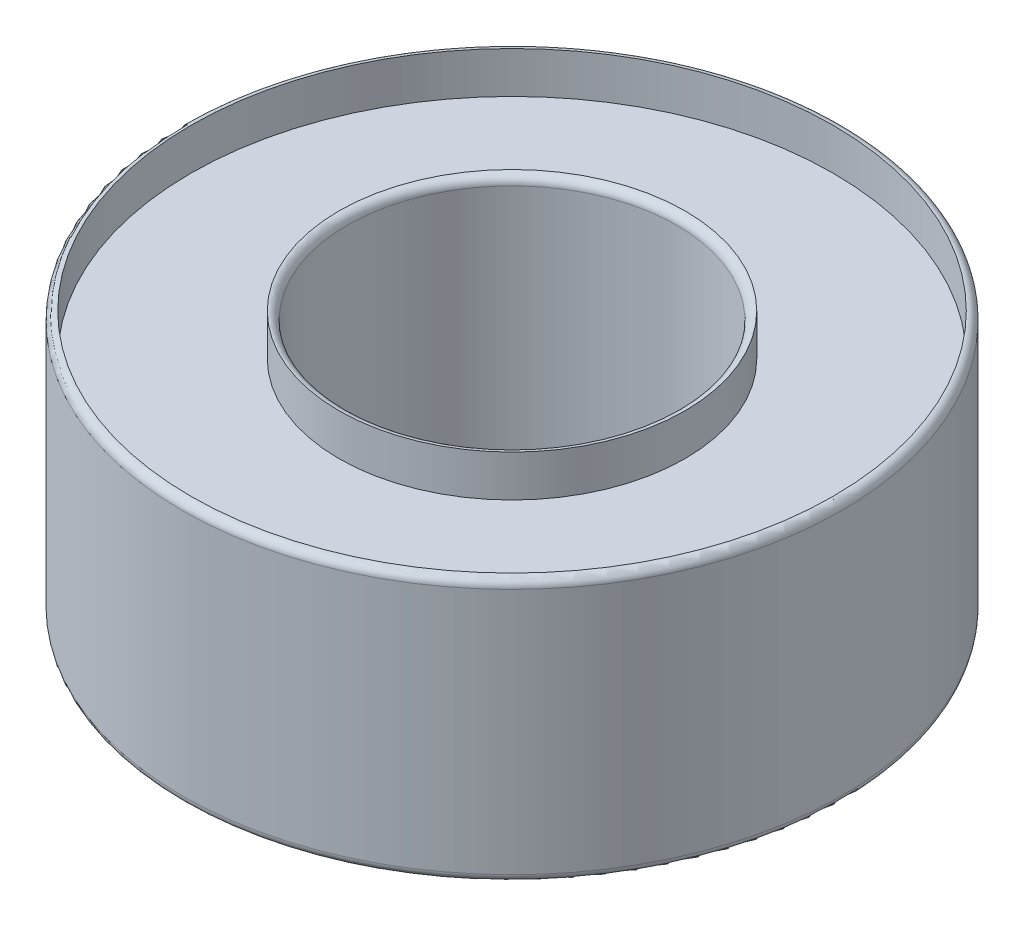
from build123d import *

# Parameters (mm, degrees)
SKETCH1_R           = 3.96875
SKETCH1_R_2         = 1.984375
BOSS_EXTRUDE1_DEPTH = 3.175
FILLET1_R           = 0.1
SKETCH2_R           = 3.86875
SKETCH2_R_2         = 2.084375
CUT_EXTRUDE1_DEPTH  = 0.5
CUT_EXTRUDE2_START  = -0.5
SKETCH3_R           = 3.86875
SKETCH3_R_2         = 2.084375
CUT_EXTRUDE2_DEPTH  = 0.5


with BuildPart() as part:
    # Sketch1 → Boss-Extrude1 (new body)
    with BuildSketch(Plane(origin=(0, 0, 0), x_dir=(1, 0, 0), z_dir=(0, 1, 0))):
        Circle(SKETCH1_R)
        Circle(SKETCH1_R_2, mode=Mode.SUBTRACT)
    extrude(amount=BOSS_EXTRUDE1_DEPTH)

    # Fillet1
    fillet1_edges = [part.edges().sort_by_distance(p)[0] for p in [
        (-1.984375, 0, 0),
        (-1.984375, 3.175, 0),
        (-3.96875, 0, 0),
        (-3.96875, 3.175, 0),
    ]]
    fillet(fillet1_edges, radius=FILLET1_R)

    # Sketch2 → Cut-Extrude1 (cut)
    with BuildSketch(Plane(origin=(0, 3.175, 0), x_dir=(1, 0, 0), z_dir=(0, 1, 0))):
        Circle(SKETCH2_R)
        Circle(SKETCH2_R_2, mode=Mode.SUBTRACT)
    extrude(amount=-CUT_EXTRUDE1_DEPTH, mode=Mode.SUBTRACT)

    # Sketch3 → Cut-Extrude2 (cut)
    with BuildSketch(Plane.XZ.offset(CUT_EXTRUDE2_START)):
        Circle(SKETCH3_R)
        Circle(SKETCH3_R_2, mode=Mode.SUBTRACT)
    extrude(amount=CUT_EXTRUDE2_DEPTH, mode=Mode.SUBTRACT)


solid = part.part
